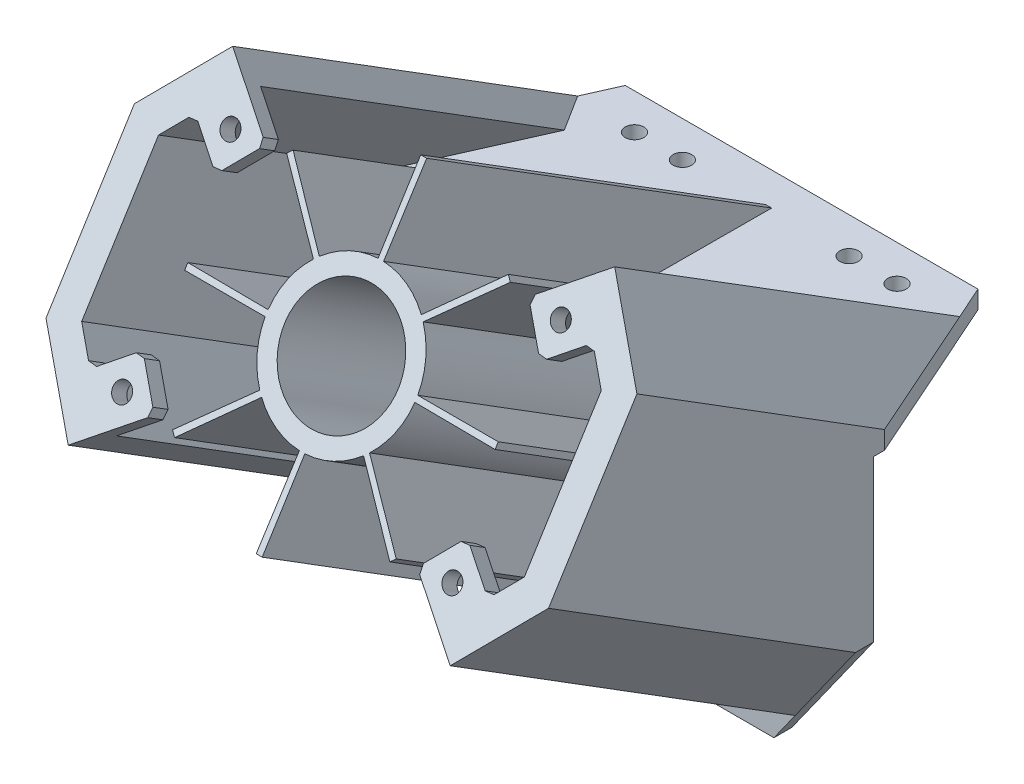
from build123d import *

# Parameters (mm, degrees)
BOSS_EXTRUDE1_DEPTH = 3
SKETCH3_W           = 84
SKETCH3_H           = 3
BOSS_EXTRUDE2_DEPTH = 30
BOSS_EXTRUDE3_DEPTH = 68
SKETCH8_R           = 9.5
BOSS_EXTRUDE4_DEPTH = 68
SKETCH9_W           = 30
SKETCH9_H           = 46
CUT_EXTRUDE3_DEPTH  = 135.04247685
CUT_EXTRUDE4_DEPTH  = 68
CUT_EXTRUDE5_DEPTH  = 68
BOSS_EXTRUDE5_DEPTH = 8
CHAMFER1_SIZE       = 1
BOSS_EXTRUDE6_DEPTH = 8
CHAMFER2_SIZE       = 1
BOSS_EXTRUDE7_DEPTH = 8
CHAMFER3_SIZE       = 1
BOSS_EXTRUDE8_DEPTH = 8
CHAMFER4_SIZE       = 1
CUT_EXTRUDE6_REACH  = 152.719
SKETCH17_R          = 1.55
CUT_EXTRUDE7_REACH  = 136.839
SKETCH18_R          = 1.55
CUT_EXTRUDE8_REACH  = 152.52
SKETCH19_R          = 1.55


with BuildPart() as part:
    # Sketch2 → Boss-Extrude1 (new body)
    with BuildSketch(Plane.XY):
        Polygon((-110, 46), (-110, 49), (-26, 49), (-26, 46), (-26, 0), (-110, 0), align=None)
    extrude(amount=BOSS_EXTRUDE1_DEPTH)

    # Sketch3 → Boss-Extrude2 (add)
    with BuildSketch(Plane(origin=(0, 0, 0), x_dir=(-1, 0, 0), z_dir=(0, 0, -1))):
        with Locations((68, 47.5)):
            Rectangle(SKETCH3_W, SKETCH3_H)
    extrude(amount=BOSS_EXTRUDE2_DEPTH)

    # Sketch7 → Boss-Extrude3 (add)
    with BuildSketch(Plane(origin=(0, 2.752263202, 4.404541836), x_dir=(1, 0, 0), z_dir=(0, 0.5299192642332059, 0.8480480961564254))):
        Polygon((-39.89941779, 5.864420737), (-36.069195574, 2.650482688), (-26, 14.650482688), (-26, 42.534332436), (-36.069195574, 54.534332436), (-39.89941779, 51.320394388), (-31, 40.714481265), (-31, 16.470333859), align=None)
        Polygon((-110, 14.650482688), (-99.930804426, 2.650482688), (-96.10058221, 5.864420737), (-105, 16.470333859), (-105, 40.714481265), (-96.10058221, 51.320394388), (-99.930804426, 54.534332436), (-110, 42.534332436), align=None)
    extrude(amount=BOSS_EXTRUDE3_DEPTH)

    # Sketch8 → Boss-Extrude4 (add)
    with BuildSketch(Plane(origin=(0, 2.752263202, 4.404541836), x_dir=(1, 0, 0), z_dir=(0, 0.5299192642332059, 0.8480480961564254))):
        with BuildLine():
            Line((-67.5, 54.534332436), (-68.5, 54.534332436))
            Line((-68.5, 54.534332436), (-68.5, 41.082403559))
            ThreePointArc((-68.5, 41.082403559), (-72.822037178, 40.124881601), (-76.539295111, 37.720958324))
            Line((-76.539295111, 37.720958324), (-85.990157605, 47.289671948))
            Line((-85.990157605, 47.289671948), (-86.697264386, 46.582565167))
            Line((-86.697264386, 46.582565167), (-77.185314257, 37.070615038))
            ThreePointArc((-77.185314257, 37.070615038), (-79.564385784, 33.337402971), (-80.493053625, 29.009074229))
            Line((-80.493053625, 29.009074229), (-93.941924874, 29.092407562))
            Line((-93.941924874, 29.092407562), (-93.941924874, 28.092407562))
            Line((-93.941924874, 28.092407562), (-80.489995997, 28.092407562))
            ThreePointArc((-80.489995997, 28.092407562), (-79.532474039, 23.770370384), (-77.128550762, 20.053112451))
            Line((-77.128550762, 20.053112451), (-86.697264386, 10.602249957))
            Line((-86.697264386, 10.602249957), (-85.990157605, 9.895143176))
            Line((-85.990157605, 9.895143176), (-76.478207476, 19.407093305))
            ThreePointArc((-76.478207476, 19.407093305), (-72.744995409, 17.028021778), (-68.416666667, 16.099353937))
            Line((-68.416666667, 16.099353937), (-68.5, 2.650482688))
            Line((-68.5, 2.650482688), (-67.5, 2.650482688))
            Line((-67.5, 2.650482688), (-67.5, 16.102411565))
            ThreePointArc((-67.5, 16.102411565), (-63.177962822, 17.059933523), (-59.460704889, 19.4638568))
            Line((-59.460704889, 19.4638568), (-50.009842395, 9.895143176))
            Line((-50.009842395, 9.895143176), (-49.302735614, 10.602249957))
            Line((-49.302735614, 10.602249957), (-58.814685743, 20.114200086))
            ThreePointArc((-58.814685743, 20.114200086), (-56.435614216, 23.847412153), (-55.506946375, 28.175740895))
            Line((-55.506946375, 28.175740895), (-42.058075126, 28.092407562))
            Line((-42.058075126, 28.092407562), (-42.058075126, 29.092407562))
            Line((-42.058075126, 29.092407562), (-55.510004003, 29.092407562))
            ThreePointArc((-55.510004003, 29.092407562), (-56.467525961, 33.41444474), (-58.871449238, 37.131702673))
            Line((-58.871449238, 37.131702673), (-49.302735614, 46.582565167))
            Line((-49.302735614, 46.582565167), (-50.009842395, 47.289671948))
            Line((-50.009842395, 47.289671948), (-59.521792524, 37.777721819))
            ThreePointArc((-59.521792524, 37.777721819), (-63.255004591, 40.156793346), (-67.583333333, 41.085461188))
            Line((-67.583333333, 41.085461188), (-67.5, 54.534332436))
        make_face()
        with Locations((-68, 28.592407562)):
            Circle(SKETCH8_R, mode=Mode.SUBTRACT)
    extrude(amount=BOSS_EXTRUDE4_DEPTH)

    # Sketch9 → Cut-Extrude3 (cut, through all)
    with BuildSketch(Plane.ZY.offset(110)):
        with Locations((-15, 23)):
            Rectangle(SKETCH9_W, SKETCH9_H)
    extrude(amount=-CUT_EXTRUDE3_DEPTH, mode=Mode.SUBTRACT)

    # Sketch11 → Cut-Extrude4 (cut)
    with BuildSketch(Plane(origin=(0, 49, 0), x_dir=(1, 0, 0), z_dir=(0, 1, 0))):
        Polygon((-26, 1.849292506), (-36.069195574, 24.494251484), (-38.517354506, 30), (-26, 30), align=None)
        Polygon((-110, 1.849292506), (-99.930804426, 24.494251484), (-97.482645494, 30), (-110, 30), align=None)
    extrude(amount=-CUT_EXTRUDE4_DEPTH, mode=Mode.SUBTRACT)

    # Sketch12 → Cut-Extrude5 (cut)
    with BuildSketch(Plane.XY.offset(3)):
        Polygon((-110, 19.15014084), (-99.930804426, 5), (-96.372820202, 0), (-110, 0), align=None)
        Polygon((-26, 19.15014084), (-36.069195574, 5), (-39.627179798, 0), (-26, 0), align=None)
    extrude(amount=-CUT_EXTRUDE5_DEPTH, mode=Mode.SUBTRACT)

    # Sketch13 → Boss-Extrude5 (add)
    with BuildSketch(Plane(origin=(-81.664497732, 58.112198911, -36.312532071), x_dir=(0.27753091374583827, -0.19749012252975667, -0.9401990445743825), z_dir=(0.766044443118982, -0.5451148086276052, 0.3406255371833096))):
        Polygon((-75.716604077, 11.344887623), (-73.010640587, 10.049603257), (-76.464732228, 2.833700616), (-79.170695719, 4.128984981), align=None)
    extrude(amount=BOSS_EXTRUDE5_DEPTH)

    # Chamfer1
    chamfer1_edges = [part.edges().sort_by_distance(p)[0] for p in [
        (-101.242883088, 76.316916776, 36.851608258),
        (-95.114527543, 71.955998307, 39.576612555),
        (-89.972226665, 77.153138559, 36.329078894),
    ]]
    chamfer(chamfer1_edges, length=CHAMFER1_SIZE)

    # Sketch14 → Boss-Extrude6 (add)
    with BuildSketch(Plane(origin=(-53.506473088, -38.075037421, 23.791923957), x_dir=(-0.27753091374583855, -0.1974901225297574, -0.9401990445743824), z_dir=(0.766044443118981, 0.5451148086276061, -0.3406255371833102))):
        Polygon((-37.409332735, 91.372162271), (-34.703369245, 90.076877905), (-31.249277603, 97.292780547), (-33.955241094, 98.588064912), align=None)
    extrude(amount=BOSS_EXTRUDE6_DEPTH)

    # Chamfer2
    chamfer2_edges = [part.edges().sort_by_distance(p)[0] for p in [
        (-89.972226665, 47.326123584, 54.967066411),
        (-95.114527543, 52.523263836, 51.71953275),
        (-101.242883088, 48.162345367, 54.444537047),
    ]]
    chamfer(chamfer2_edges, length=CHAMFER2_SIZE)

    # Sketch15 → Boss-Extrude7 (add)
    with BuildSketch(Plane(origin=(1.856421651, 1.321023789, -0.825467279), x_dir=(0.27753091374583844, 0.1974901225297572, 0.9401990445743825), z_dir=(-0.7660444431189815, -0.5451148086276059, 0.34062553718331))):
        Polygon((37.972399808, 90.195865404), (35.266436317, 88.900581038), (38.720527959, 81.684678396), (41.426491449, 82.979962762), align=None)
    extrude(amount=BOSS_EXTRUDE7_DEPTH)

    # Chamfer3
    chamfer3_edges = [part.edges().sort_by_distance(p)[0] for p in [
        (-34.757116912, 76.316916776, 36.851608258),
        (-40.885472457, 71.955998307, 39.576612555),
        (-46.027773335, 77.153138559, 36.329078894),
    ]]
    chamfer(chamfer3_edges, length=CHAMFER3_SIZE)

    # Sketch16 → Boss-Extrude8 (add)
    with BuildSketch(Plane(origin=(-26.301602994, 18.716137701, -11.695140835), x_dir=(-0.27753091374583827, 0.19749012252975673, 0.9401990445743825), z_dir=(-0.7660444431189819, 0.5451148086276052, -0.3406255371833096))):
        Polygon((75.153537005, 12.52118449), (72.447573514, 11.225900124), (68.993481872, 18.441802766), (71.699445363, 19.737087131), align=None)
    extrude(amount=BOSS_EXTRUDE8_DEPTH)

    # Chamfer4
    chamfer4_edges = [part.edges().sort_by_distance(p)[0] for p in [
        (-34.757116912, 48.162345367, 54.444537047),
        (-46.027773335, 47.326123584, 54.967066411),
        (-40.885472457, 52.523263836, 51.71953275),
    ]]
    chamfer(chamfer4_edges, length=CHAMFER4_SIZE)

    # Sketch17 → Cut-Extrude6 (cut, up to next)
    with BuildSketch(Plane(origin=(0, 38.78677317, 62.071812375), x_dir=(1, 0, 0), z_dir=(0, 0.5299192642332061, 0.8480480961564253)), mode=Mode.PRIVATE) as cut_extrude6_sk1:
        with Locations((-95.607554877, 45.685066176)):
            Circle(SKETCH17_R)
    cut_extrude6_tool1 = extrude(cut_extrude6_sk1.sketch, amount=-CUT_EXTRUDE6_REACH, mode=Mode.PRIVATE) & part.part
    # Sketch17 → Cut-Extrude6 (cut, up to next)
    with BuildSketch(Plane(origin=(0, 38.78677317, 62.071812375), x_dir=(1, 0, 0), z_dir=(0, 0.5299192642332061, 0.8480480961564253)), mode=Mode.PRIVATE) as cut_extrude6_sk2:
        with Locations((-95.607554877, 11.499748948)):
            Circle(SKETCH17_R)
    cut_extrude6_tool2 = extrude(cut_extrude6_sk2.sketch, amount=-CUT_EXTRUDE6_REACH, mode=Mode.PRIVATE) & part.part
    # Sketch17 → Cut-Extrude6 (cut, up to next)
    with BuildSketch(Plane(origin=(0, 38.78677317, 62.071812375), x_dir=(1, 0, 0), z_dir=(0, 0.5299192642332061, 0.8480480961564253)), mode=Mode.PRIVATE) as cut_extrude6_sk3:
        with Locations((-40.392445123, 45.685066176)):
            Circle(SKETCH17_R)
    cut_extrude6_tool3 = extrude(cut_extrude6_sk3.sketch, amount=-CUT_EXTRUDE6_REACH, mode=Mode.PRIVATE) & part.part
    # Sketch17 → Cut-Extrude6 (cut, up to next)
    with BuildSketch(Plane(origin=(0, 38.78677317, 62.071812375), x_dir=(1, 0, 0), z_dir=(0, 0.5299192642332061, 0.8480480961564253)), mode=Mode.PRIVATE) as cut_extrude6_sk4:
        with Locations((-40.392445123, 11.499748948)):
            Circle(SKETCH17_R)
    cut_extrude6_tool4 = extrude(cut_extrude6_sk4.sketch, amount=-CUT_EXTRUDE6_REACH, mode=Mode.PRIVATE) & part.part
    add(cut_extrude6_tool1.solids().sort_by_distance((-95.607555, 77.529907, 37.862416))[0], mode=Mode.SUBTRACT)
    add(cut_extrude6_tool2.solids().sort_by_distance((-95.607555, 48.539113, 55.977874))[0], mode=Mode.SUBTRACT)
    add(cut_extrude6_tool3.solids().sort_by_distance((-40.392445, 77.529907, 37.862416))[0], mode=Mode.SUBTRACT)
    add(cut_extrude6_tool4.solids().sort_by_distance((-40.392445, 48.539113, 55.977874))[0], mode=Mode.SUBTRACT)

    # Sketch18 → Cut-Extrude7 (cut, up to next)
    with BuildSketch(Plane(origin=(0, 49, 0), x_dir=(1, 0, 0), z_dir=(0, 1, 0)), mode=Mode.PRIVATE) as cut_extrude7_sk1:
        with Locations((-89.930804426, 24)):
            Circle(SKETCH18_R)
    cut_extrude7_tool1 = extrude(cut_extrude7_sk1.sketch, amount=-CUT_EXTRUDE7_REACH, mode=Mode.PRIVATE) & part.part
    # Sketch18 → Cut-Extrude7 (cut, up to next)
    with BuildSketch(Plane(origin=(0, 49, 0), x_dir=(1, 0, 0), z_dir=(0, 1, 0)), mode=Mode.PRIVATE) as cut_extrude7_sk2:
        with Locations((-81.930804426, 24)):
            Circle(SKETCH18_R)
    cut_extrude7_tool2 = extrude(cut_extrude7_sk2.sketch, amount=-CUT_EXTRUDE7_REACH, mode=Mode.PRIVATE) & part.part
    # Sketch18 → Cut-Extrude7 (cut, up to next)
    with BuildSketch(Plane(origin=(0, 49, 0), x_dir=(1, 0, 0), z_dir=(0, 1, 0)), mode=Mode.PRIVATE) as cut_extrude7_sk3:
        with Locations((-54.069195574, 24)):
            Circle(SKETCH18_R)
    cut_extrude7_tool3 = extrude(cut_extrude7_sk3.sketch, amount=-CUT_EXTRUDE7_REACH, mode=Mode.PRIVATE) & part.part
    # Sketch18 → Cut-Extrude7 (cut, up to next)
    with BuildSketch(Plane(origin=(0, 49, 0), x_dir=(1, 0, 0), z_dir=(0, 1, 0)), mode=Mode.PRIVATE) as cut_extrude7_sk4:
        with Locations((-46.069195574, 24)):
            Circle(SKETCH18_R)
    cut_extrude7_tool4 = extrude(cut_extrude7_sk4.sketch, amount=-CUT_EXTRUDE7_REACH, mode=Mode.PRIVATE) & part.part
    add(cut_extrude7_tool1.solids().sort_by_distance((-89.930804, 49, -24))[0], mode=Mode.SUBTRACT)
    add(cut_extrude7_tool2.solids().sort_by_distance((-81.930804, 49, -24))[0], mode=Mode.SUBTRACT)
    add(cut_extrude7_tool3.solids().sort_by_distance((-54.069196, 49, -24))[0], mode=Mode.SUBTRACT)
    add(cut_extrude7_tool4.solids().sort_by_distance((-46.069196, 49, -24))[0], mode=Mode.SUBTRACT)

    # Sketch19 → Cut-Extrude8 (cut, up to next)
    with BuildSketch(Plane.XY.offset(3), mode=Mode.PRIVATE) as cut_extrude8_sk1:
        with Locations((-89.930804426, 8)):
            Circle(SKETCH19_R)
    cut_extrude8_tool1 = extrude(cut_extrude8_sk1.sketch, amount=-CUT_EXTRUDE8_REACH, mode=Mode.PRIVATE) & part.part
    # Sketch19 → Cut-Extrude8 (cut, up to next)
    with BuildSketch(Plane.XY.offset(3), mode=Mode.PRIVATE) as cut_extrude8_sk2:
        with Locations((-46.069195574, 8)):
            Circle(SKETCH19_R)
    cut_extrude8_tool2 = extrude(cut_extrude8_sk2.sketch, amount=-CUT_EXTRUDE8_REACH, mode=Mode.PRIVATE) & part.part
    add(cut_extrude8_tool1.solids().sort_by_distance((-89.930804, 8, 3))[0], mode=Mode.SUBTRACT)
    add(cut_extrude8_tool2.solids().sort_by_distance((-46.069196, 8, 3))[0], mode=Mode.SUBTRACT)


solid = part.part
